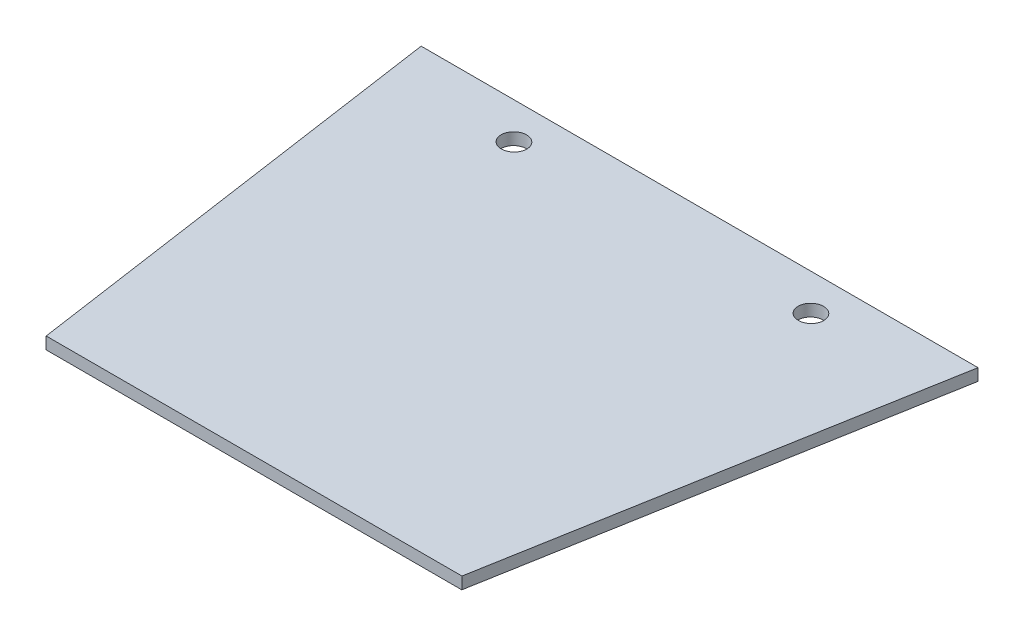
from build123d import *

# Parameters (mm, degrees)
BOSS_EXTRUDE1_DEPTH    = 1.6
FRONT_MOUNTING_HOLES_R = 1.7
CUT_EXTRUDE1_DEPTH     = 63.023347948


with BuildPart() as part:
    # Sketch1 → Boss-Extrude1 (new body)
    with BuildSketch(Plane(origin=(0, -24.223665143, 0.381097525), x_dir=(-1, 0, 0), z_dir=(0, -0.9998762680261353, 0.015730500250406433))):
        Polygon((-37.5, 49.35220397), (-28, -10.655220867), (28, -10.655220867), (37.5, 49.35220397), align=None)
    extrude(amount=BOSS_EXTRUDE1_DEPTH)

    # Front Mounting Holes → Cut-Extrude1 (cut, through all)
    with BuildSketch(Plane(origin=(0, -25.823467172, 0.406266325), x_dir=(1, 0, 0), z_dir=(0, -0.9998762680261353, 0.015730500250406433))):
        with Locations((20, -44.35220397)):
            Circle(FRONT_MOUNTING_HOLES_R)
        with Locations((-20, -44.35220397)):
            Circle(FRONT_MOUNTING_HOLES_R)
    extrude(amount=-CUT_EXTRUDE1_DEPTH, mode=Mode.SUBTRACT)


solid = part.part
